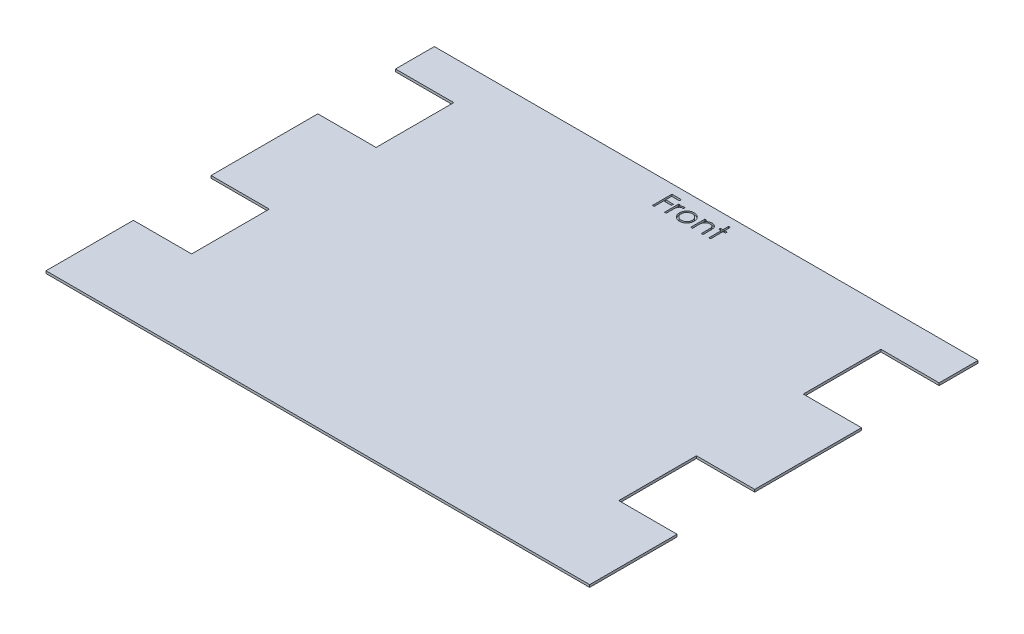
from build123d import *

# Parameters (mm, degrees)
BOSS_EXTRUDE1_DEPTH = 3.175
CUT_EXTRUDE1_DEPTH  = 2.54


with BuildPart() as part:
    # Sketch1 → Boss-Extrude1 (new body)
    with BuildSketch(Plane(origin=(0, 0, 0), x_dir=(1, 0, 0), z_dir=(0, 1, 0))):
        Polygon((-355.6, 203.2), (-279.4, 203.2), (-279.4, 101.6), (-355.6, 101.6), (-355.6, -38.1), (-279.4, -38.1), (-279.4, -139.7), (-355.6, -139.7), (-355.6, -254), (355.6, -254), (355.6, -139.7), (279.4, -139.7), (279.4, -38.1), (355.6, -38.1), (355.6, 101.6), (279.4, 101.6), (279.4, 203.2), (355.6, 203.2), (355.6, 254), (-355.6, 254), align=None)
    extrude(amount=BOSS_EXTRUDE1_DEPTH)

    # Sketch3 → Cut-Extrude1 (cut)
    # profile 1 of 5: a face of its own
    with BuildSketch(Plane(origin=(0, 3.175, 0), x_dir=(1, 0, 0), z_dir=(0, 1, 0))):
        Polygon((-32.986222619, 242.174474666), (-20.611863644, 242.174474666), (-20.611863644, 239.569346461), (-30.706735439, 239.569346461), (-30.706735439, 231.753961845), (-20.611863644, 231.753961845), (-20.611863644, 229.14883364), (-30.706735439, 229.14883364), (-30.706735439, 216.774474666), (-32.986222619, 216.774474666), align=None)
    # profile 2 of 5: a face of its own
    with BuildSketch(Plane(origin=(0, 3.175, 0), x_dir=(1, 0, 0), z_dir=(0, 1, 0))):
        with BuildLine():
            Line((-17.355453388, 235.336013127), (-15.075966208, 235.336013127))
            Line((-15.075966208, 235.336013127), (-15.075966208, 232.603681396))
            add(Edge.make_bspline(
                [(-15.075966208, 232.603681396), (-14.907682073, 232.858086551), (-14.585839973, 233.344634431), (-14.050894714, 233.988120216), (-13.502956253, 234.520903697), (-12.939401465, 234.94547209), (-12.356086111, 235.263430152), (-11.765812233, 235.496333892), (-11.159293109, 235.63405498), (-10.751718002, 235.652442105), (-10.547520696, 235.661654153)],
                knots=[0, 0, 0, 0, 1.2804753, 2.448899062, 3.506932113, 4.484331642, 5.4025378, 6.288909075, 7.142734305, 8, 8, 8, 8], degree=3))
            add(Edge.make_bspline(
                [(-10.547520696, 235.661654153), (-10.389123926, 235.653014331), (-10.063212279, 235.635237337), (-9.569852913, 235.510335924), (-9.061537577, 235.310923989), (-8.733932823, 235.123397801), (-8.563145696, 235.025636525)],
                knots=[0, 0, 0, 0, 0.901110191, 1.854092781, 2.881294221, 4, 4, 4, 4], degree=3))
            Line((-8.563145696, 235.025636525), (-9.814828388, 233.051437807))
            add(Edge.make_bspline(
                [(-9.814828388, 233.051437807), (-9.924476713, 233.100352881), (-10.132610224, 233.193203056), (-10.437080505, 233.303090786), (-10.717796491, 233.367794861), (-10.896638315, 233.377597211), (-10.980012683, 233.382166973)],
                knots=[0, 0, 0, 0, 1.180555205, 2.24091978, 3.179933427, 4, 4, 4, 4], degree=3))
            add(Edge.make_bspline(
                [(-10.980012683, 233.382166973), (-11.162934292, 233.369974702), (-11.53604135, 233.345106003), (-12.083843146, 233.149607227), (-12.61540858, 232.833738341), (-13.037568644, 232.483427987), (-13.364446708, 232.145623971), (-13.597692916, 231.850632707), (-13.811653422, 231.519862066), (-14.016088736, 231.158966647), (-14.2023527, 230.761784336), (-14.376195156, 230.332283301), (-14.533376619, 229.869966081), (-14.623004105, 229.547875791), (-14.668914926, 229.382888127)],
                knots=[0, 0, 0, 0, 1.125678352, 2.296057538, 3.5422874, 4.923748041, 5.663163013, 6.437101912, 7.23742474, 8.08941207, 8.991984279, 9.93940061, 10.944477711, 12, 12, 12, 12], degree=3))
            add(Edge.make_bspline(
                [(-14.668914926, 229.382888127), (-14.703258581, 229.235733782), (-14.779327166, 228.909798089), (-14.853288613, 228.362983081), (-14.926364543, 227.716925672), (-14.977865716, 226.96982754), (-15.025603508, 226.123554376), (-15.052528104, 225.176816942), (-15.075048039, 224.128643479), (-15.075650867, 223.395858173), (-15.075966208, 223.012535563)],
                knots=[0, 0, 0, 0, 0.566838948, 1.255505196, 2.06880316, 3.007127437, 4.065329342, 5.249902469, 6.561414163, 8, 8, 8, 8], degree=3))
            Line((-15.075966208, 223.012535563), (-15.075966208, 216.774474666))
            Line((-15.075966208, 216.774474666), (-17.355453388, 216.774474666))
            Line((-17.355453388, 216.774474666), (-17.355453388, 235.336013127))
        make_face()
    # profile 3 of 5: a face of its own
    with BuildSketch(Plane(origin=(0, 3.175, 0), x_dir=(1, 0, 0), z_dir=(0, 1, 0))):
        with BuildLine():
            add(Edge.make_bspline(
                [(2.681645971, 235.661654153), (3.029925494, 235.654238143), (3.712816523, 235.63969716), (4.712908038, 235.484285695), (5.667549882, 235.246633393), (6.580398248, 234.9180912), (7.43976222, 234.477713616), (8.258159249, 233.952229046), (9.033345542, 233.32969251), (9.497969811, 232.848122528), (9.733809433, 232.603681396)],
                knots=[0, 0, 0, 0, 1.054011418, 2.066658804, 3.057071809, 4.030435133, 4.997543892, 5.974964718, 6.972108034, 8, 8, 8, 8], degree=3))
            add(Edge.make_bspline(
                [(9.733809433, 232.603681396), (9.936878471, 232.3698999), (10.339086602, 231.906861222), (10.854820675, 231.156069059), (11.299114283, 230.378538043), (11.6551712, 229.563943158), (11.935913943, 228.719395545), (12.135236425, 227.841992378), (12.253795895, 226.933671345), (12.269783141, 226.316786348), (12.277879946, 226.004362486)],
                knots=[0, 0, 0, 0, 1.025258237, 2.030674902, 3.01204498, 3.988269485, 4.97094183, 5.956517959, 6.965070386, 8, 8, 8, 8], degree=3))
            add(Edge.make_bspline(
                [(12.277879946, 226.004362486), (12.27075824, 225.690127782), (12.256685419, 225.069185352), (12.123563174, 224.154644811), (11.916509008, 223.267859527), (11.620186525, 222.412542149), (11.240216247, 221.586078202), (10.7765524, 220.792077472), (10.225941236, 220.02897342), (9.601797945, 219.303245793), (8.911992901, 218.634382406), (8.163664282, 218.051428678), (7.371517865, 217.551981044), (6.525020387, 217.149671057), (5.631902054, 216.832463517), (4.690236474, 216.609669112), (3.701486535, 216.474964322), (3.0263747, 216.45766639), (2.681645971, 216.44883364)],
                knots=[0, 0, 0, 0, 0.998656419, 1.973391657, 2.932242238, 3.890759089, 4.846373663, 5.82037756, 6.809684879, 7.83454468, 8.860553229, 9.859544525, 10.845671541, 11.83227036, 12.833544569, 13.85385346, 14.904124723, 16, 16, 16, 16], degree=3))
            add(Edge.make_bspline(
                [(2.681645971, 216.44883364), (2.335228292, 216.457696035), (1.656751768, 216.475053485), (0.664511784, 216.609145765), (-0.27884145, 216.832360838), (-1.173128994, 217.1507135), (-2.023265883, 217.551993903), (-2.820002175, 218.049918736), (-3.568938705, 218.634555291), (-4.258889677, 219.303198949), (-4.882993842, 220.028985489), (-5.433615102, 220.79207434), (-5.897276327, 221.586079018), (-6.277247292, 222.412541931), (-6.573569591, 223.267859585), (-6.780623807, 224.154644795), (-6.913746038, 225.069185356), (-6.927818861, 225.690127783), (-6.934940567, 226.004362486)],
                knots=[0, 0, 0, 0, 1.099876186, 2.154163076, 3.173186993, 4.173200201, 5.163417411, 6.152872554, 7.150605724, 8.17532212, 9.198891216, 10.186952605, 11.159729845, 12.11414092, 13.071450619, 14.029093627, 15.002601286, 16, 16, 16, 16], degree=3))
            add(Edge.make_bspline(
                [(-6.934940567, 226.004362486), (-6.926788544, 226.315088276), (-6.910648938, 226.93027194), (-6.792208672, 227.836885465), (-6.593663719, 228.71280366), (-6.312584442, 229.5540914), (-5.953245628, 230.365116565), (-5.515195138, 231.144568767), (-4.994200262, 231.891965947), (-4.593591814, 232.354406185), (-4.390870054, 232.588416973)],
                knots=[0, 0, 0, 0, 1.031353054, 2.041901799, 3.029428768, 4.008703097, 4.981709435, 5.96992636, 6.972712378, 8, 8, 8, 8], degree=3))
            add(Edge.make_bspline(
                [(-4.390870054, 232.588416973), (-4.155385994, 232.834977961), (-3.692265153, 233.319883528), (-2.913220101, 233.940605274), (-2.09683637, 234.477024782), (-1.227975478, 234.908652174), (-0.315877023, 235.248565988), (0.643656909, 235.484898584), (1.647142078, 235.639137217), (2.333374757, 235.654073707), (2.681645971, 235.661654153)],
                knots=[0, 0, 0, 0, 1.027980169, 2.021703884, 2.998553061, 3.971491411, 4.943284454, 5.930300938, 6.949603206, 8, 8, 8, 8], degree=3))
        make_face()
        with BuildLine():
            add(Edge.make_bspline(
                [(2.671469689, 233.382166973), (2.425179596, 233.375166794), (1.938957347, 233.361347143), (1.223260933, 233.256235378), (0.534266673, 233.089702062), (-0.129332596, 232.853089768), (-0.765299047, 232.547572045), (-1.374241568, 232.172317088), (-1.957951274, 231.732295061), (-2.505009677, 231.22819453), (-3.0070756, 230.677529827), (-3.445972915, 230.090801736), (-3.819172259, 229.477527109), (-4.130069412, 228.837068205), (-4.361624434, 228.162934687), (-4.529794369, 227.462760964), (-4.634806971, 226.735120513), (-4.64849669, 226.240466265), (-4.655453388, 225.989098063)],
                knots=[0, 0, 0, 0, 1.021534396, 2.016698045, 2.994645724, 3.958388632, 4.93408049, 5.916473867, 6.921342795, 7.962252576, 8.998418191, 10.008913653, 10.997312074, 11.973003931, 12.956656626, 13.948281152, 14.957379055, 16, 16, 16, 16], degree=3))
            add(Edge.make_bspline(
                [(-4.655453388, 225.989098063), (-4.643792439, 225.664326209), (-4.620647637, 225.019714809), (-4.432431921, 224.070399805), (-4.11757149, 223.159034363), (-3.692395231, 222.290961162), (-3.159675816, 221.48779663), (-2.532026817, 220.771723572), (-1.81618442, 220.153517969), (-1.020681819, 219.640576975), (-0.161767626, 219.233017606), (0.74723539, 218.944190753), (1.695313569, 218.756436185), (2.34323659, 218.737774629), (2.671469689, 218.72832082)],
                knots=[0, 0, 0, 0, 1.016792936, 2.018143844, 3.017858371, 4.030088057, 5.03801393, 6.028138512, 7.003788237, 7.991172063, 8.984598303, 9.972568034, 10.972917682, 12, 12, 12, 12], degree=3))
            add(Edge.make_bspline(
                [(2.671469689, 218.72832082), (2.999683909, 218.737829711), (3.647569663, 218.756599997), (4.594330546, 218.943245146), (5.500849085, 219.234283141), (6.358871154, 219.640118607), (7.154011648, 220.155465846), (7.875002414, 220.768232697), (8.497292335, 221.489693218), (9.029484782, 222.292024998), (9.461624, 223.157688582), (9.775010665, 224.07056801), (9.96367886, 225.019671971), (9.986762588, 225.664311857), (9.998392766, 225.989098063)],
                knots=[0, 0, 0, 0, 1.02726834, 2.027799167, 3.010890988, 4.004497153, 4.992059811, 5.971914811, 6.958719428, 7.966827853, 8.981595046, 9.981490638, 10.983022906, 12, 12, 12, 12], degree=3))
            add(Edge.make_bspline(
                [(9.998392766, 225.989098063), (9.991438464, 226.240467768), (9.977753458, 226.735124971), (9.872706574, 227.46274392), (9.704663514, 228.162997221), (9.472640921, 228.836837474), (9.163094649, 229.479185362), (8.782698493, 230.089001096), (8.345593337, 230.679562316), (7.837469089, 231.226414452), (7.290981718, 231.732491574), (6.70703544, 232.172487714), (6.098995882, 232.545922836), (5.464877025, 232.855702982), (4.801192677, 233.087549394), (4.113163796, 233.257196949), (3.400521004, 233.360902947), (2.916041091, 233.375033631), (2.671469689, 233.382166973)],
                knots=[0, 0, 0, 0, 1.042956736, 2.052379634, 3.044323526, 4.02829302, 5.004299113, 5.996692471, 7.007513377, 8.048758398, 9.090003419, 10.095195979, 11.07790575, 12.047570684, 13.018257071, 13.989683339, 14.985167495, 16, 16, 16, 16], degree=3))
        make_face(mode=Mode.SUBTRACT)
    # profile 4 of 5: a face of its own
    with BuildSketch(Plane(origin=(0, 3.175, 0), x_dir=(1, 0, 0), z_dir=(0, 1, 0))):
        with BuildLine():
            Line((16.836854304, 235.336013127), (19.116341484, 235.336013127))
            Line((19.116341484, 235.336013127), (19.116341484, 231.988016332))
            add(Edge.make_bspline(
                [(19.116341484, 231.988016332), (19.359728893, 232.29167495), (19.832030652, 232.88093509), (20.618591242, 233.655421546), (21.44985269, 234.293652607), (22.320724373, 234.802405855), (23.232388503, 235.18592137), (24.179287948, 235.462896985), (25.167091815, 235.628975455), (25.838845157, 235.650675983), (26.178681228, 235.661654153)],
                knots=[0, 0, 0, 0, 1.12780773, 2.188550248, 3.19190651, 4.159438251, 5.104880172, 6.052711206, 7.014878035, 8, 8, 8, 8], degree=3))
            add(Edge.make_bspline(
                [(26.178681228, 235.661654153), (26.522166401, 235.64898902), (27.194449738, 235.624200301), (28.173279098, 235.428136314), (29.087486012, 235.093253605), (29.933810789, 234.63451458), (30.696733994, 234.064056173), (31.366748631, 233.399463128), (31.920927626, 232.635024124), (32.292474203, 231.925833219), (32.537226046, 231.296720255), (32.691312153, 230.757900983), (32.822165561, 230.157603543), (32.93560739, 229.497641954), (33.012367001, 228.77339223), (33.072908203, 227.987823265), (33.116296441, 227.141189518), (33.118017886, 226.555635136), (33.118905587, 226.253681396)],
                knots=[0, 0, 0, 0, 1.235846778, 2.418850247, 3.575807741, 4.728682307, 5.871620074, 6.994088408, 8.11269785, 9.256955736, 9.865816715, 10.540099792, 11.271859618, 12.076849838, 12.949306005, 13.892391288, 14.913166135, 16, 16, 16, 16], degree=3))
            Line((33.118905587, 226.253681396), (33.118905587, 216.774474666))
            Line((33.118905587, 216.774474666), (30.839418407, 216.774474666))
            Line((30.839418407, 216.774474666), (30.839418407, 225.505724666))
            add(Edge.make_bspline(
                [(30.839418407, 225.505724666), (30.838016269, 225.758436123), (30.835334217, 226.241830133), (30.826874953, 226.933936758), (30.806483785, 227.561582213), (30.777830314, 228.123265965), (30.735891064, 228.618448665), (30.692183968, 229.048138844), (30.638735279, 229.411790952), (30.591107281, 229.630703264), (30.569746933, 229.728881717)],
                knots=[0, 0, 0, 0, 1.430800155, 2.736877192, 3.918605307, 4.986035426, 5.920637409, 6.731861385, 7.431261377, 8, 8, 8, 8], degree=3))
            add(Edge.make_bspline(
                [(30.569746933, 229.728881717), (30.492635933, 230.017071459), (30.344221115, 230.571747549), (29.97748878, 231.324127136), (29.514380154, 231.964193985), (28.949064333, 232.487990765), (28.287001898, 232.895630551), (27.530030062, 233.178470108), (26.685453641, 233.355372176), (26.091424693, 233.37298622), (25.781806228, 233.382166973)],
                knots=[0, 0, 0, 0, 1.084156227, 2.086665306, 3.027808233, 3.945421172, 4.874247719, 5.839848303, 6.874090471, 8, 8, 8, 8], degree=3))
            add(Edge.make_bspline(
                [(25.781806228, 233.382166973), (25.598435038, 233.37871254), (25.235548192, 233.371876304), (24.697431253, 233.303286884), (24.175467253, 233.191102664), (23.664417736, 233.03965598), (23.174504033, 232.831649798), (22.689986034, 232.595579511), (22.229108375, 232.301315344), (21.782043721, 231.973360548), (21.366116489, 231.609928588), (20.979105118, 231.226428428), (20.634114914, 230.818028332), (20.321559385, 230.391308713), (20.051751417, 229.940409089), (19.81623472, 229.46967955), (19.61640425, 228.978500527), (19.517106996, 228.637595797), (19.467423215, 228.467022743)],
                knots=[0, 0, 0, 0, 1.023777757, 2.026029729, 3.023749952, 4.003683103, 4.997618607, 5.993177895, 7.010360494, 8.046726602, 9.087585522, 10.09234134, 11.086953743, 12.070360549, 13.043493632, 14.017870808, 15.008233677, 16, 16, 16, 16], degree=3))
            add(Edge.make_bspline(
                [(19.467423215, 228.467022743), (19.438832622, 228.341799269), (19.376592398, 228.069194318), (19.309368178, 227.62183196), (19.248353203, 227.104325284), (19.197284989, 226.517278183), (19.166039966, 225.858635318), (19.131972058, 225.131209524), (19.119569158, 224.332100208), (19.117447503, 223.775755352), (19.116341484, 223.485732679)],
                knots=[0, 0, 0, 0, 0.615963638, 1.340920617, 2.168419149, 3.115676021, 4.16674242, 5.331190069, 6.6087489, 8, 8, 8, 8], degree=3))
            Line((19.116341484, 223.485732679), (19.116341484, 216.774474666))
            Line((19.116341484, 216.774474666), (16.836854304, 216.774474666))
            Line((16.836854304, 216.774474666), (16.836854304, 235.336013127))
        make_face()
    # profile 5 of 5: a face of its own
    with BuildSketch(Plane(origin=(0, 3.175, 0), x_dir=(1, 0, 0), z_dir=(0, 1, 0))):
        Polygon((40.608649176, 242.825756717), (42.888136356, 242.825756717), (42.888136356, 235.336013127), (46.144546612, 235.336013127), (46.144546612, 233.056525948), (42.888136356, 233.056525948), (42.888136356, 216.774474666), (40.608649176, 216.774474666), (40.608649176, 233.056525948), (37.35223892, 233.056525948), (37.35223892, 235.336013127), (40.608649176, 235.336013127), align=None)
    extrude(amount=-CUT_EXTRUDE1_DEPTH, mode=Mode.SUBTRACT)


solid = part.part
